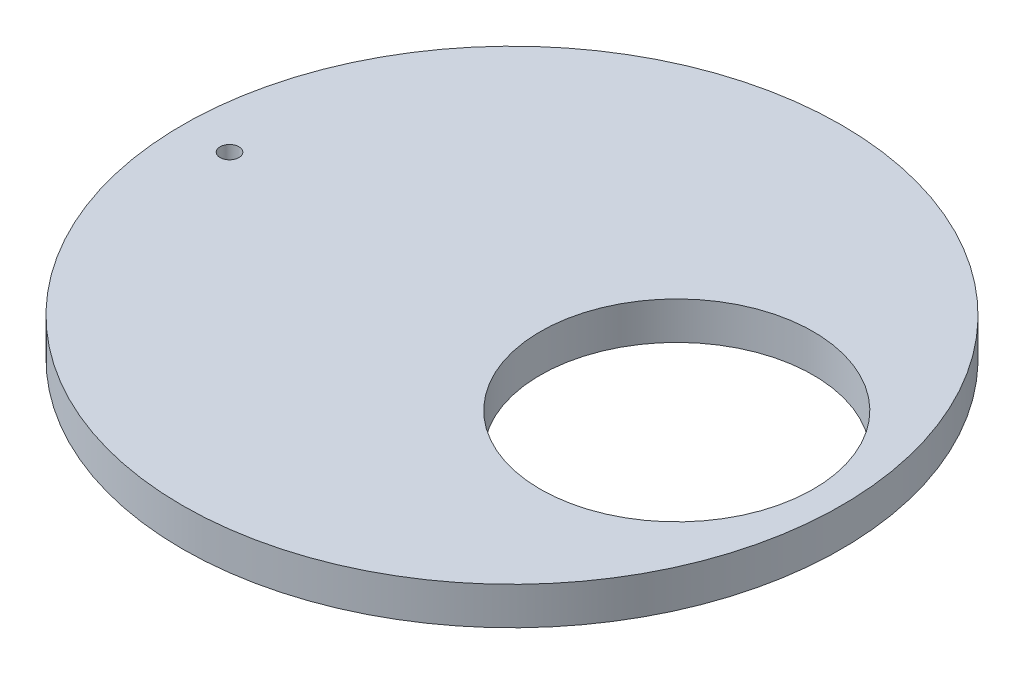
from build123d import *

# Parameters (mm, degrees)
SKETCH1_R           = 70
BOSS_EXTRUDE1_DEPTH = 8
CUT_EXTRUDE1_REACH  = 101.318
SKETCH2_R           = 2
SKETCH3_R           = 2.4
CUT_EXTRUDE2_DEPTH  = 2


with BuildPart() as part:
    # Sketch1 → Boss-Extrude1 (new body)
    with BuildSketch(Plane(origin=(0, 0, 0), x_dir=(1, 0, 0), z_dir=(0, 1, 0))):
        Circle(SKETCH1_R)
        with BuildLine():
            ThreePointArc((35, -29), (6, 0), (35, 29))
            ThreePointArc((35, 29), (55.506096654, 20.506096654), (64, 0))
            ThreePointArc((64, 0), (55.506096654, -20.506096654), (35, -29))
        make_face(mode=Mode.SUBTRACT)
    extrude(amount=BOSS_EXTRUDE1_DEPTH)

    # Sketch2 → Cut-Extrude1 (cut, up to next)
    with BuildSketch(Plane(origin=(0, 8, 0), x_dir=(1, 0, 0), z_dir=(0, 1, 0)), mode=Mode.PRIVATE) as cut_extrude1_sk1:
        with Locations((-59.999999981, -0.001490332)):
            Circle(SKETCH2_R)
    cut_extrude1_tool1 = extrude(cut_extrude1_sk1.sketch, amount=-CUT_EXTRUDE1_REACH, mode=Mode.PRIVATE) & part.part
    add(cut_extrude1_tool1.solids().sort_by_distance((-60, 8, 0.00149))[0], mode=Mode.SUBTRACT)

    # Sketch3 → Cut-Extrude2 (cut)
    with BuildSketch(Plane.XZ):
        with Locations((-59.999999981, 0.001490332)):
            Circle(SKETCH3_R)
    extrude(amount=-CUT_EXTRUDE2_DEPTH, mode=Mode.SUBTRACT)


solid = part.part
